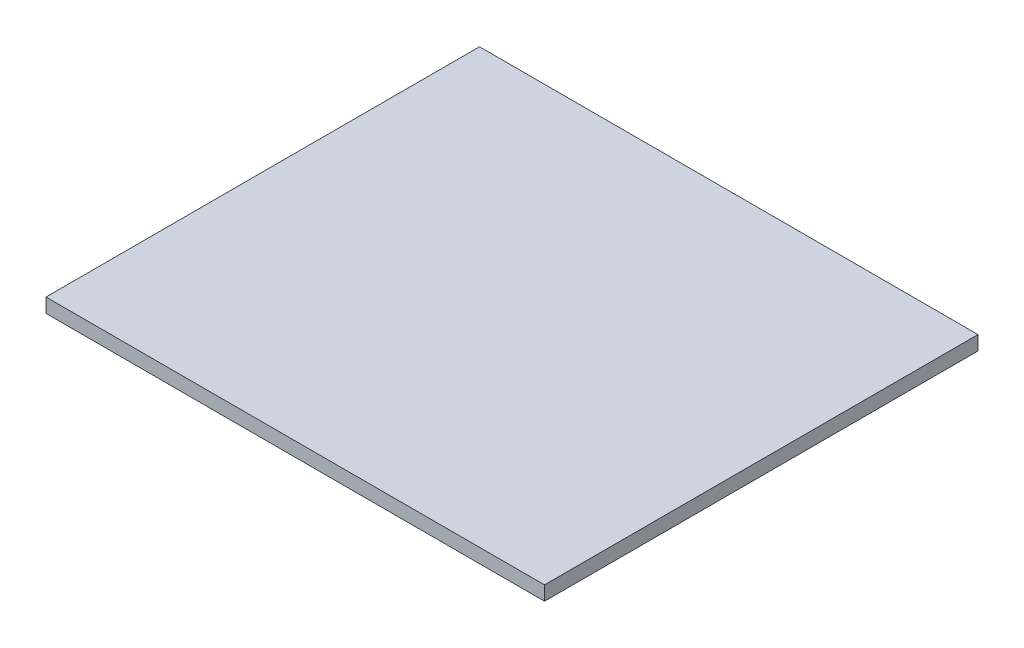
from build123d import *

# Parameters (mm, degrees)
SKETCH1_W           = 89.064952438
SKETCH1_H           = 77.44778473
BOSS_EXTRUDE1_DEPTH = 2.54


with BuildPart() as part:
    # Sketch1 → Boss-Extrude1 (new body)
    with BuildSketch(Plane(origin=(0, 0, 0), x_dir=(1, 0, 0), z_dir=(0, 1, 0))):
        Rectangle(SKETCH1_W, SKETCH1_H)
    extrude(amount=BOSS_EXTRUDE1_DEPTH)


solid = part.part
